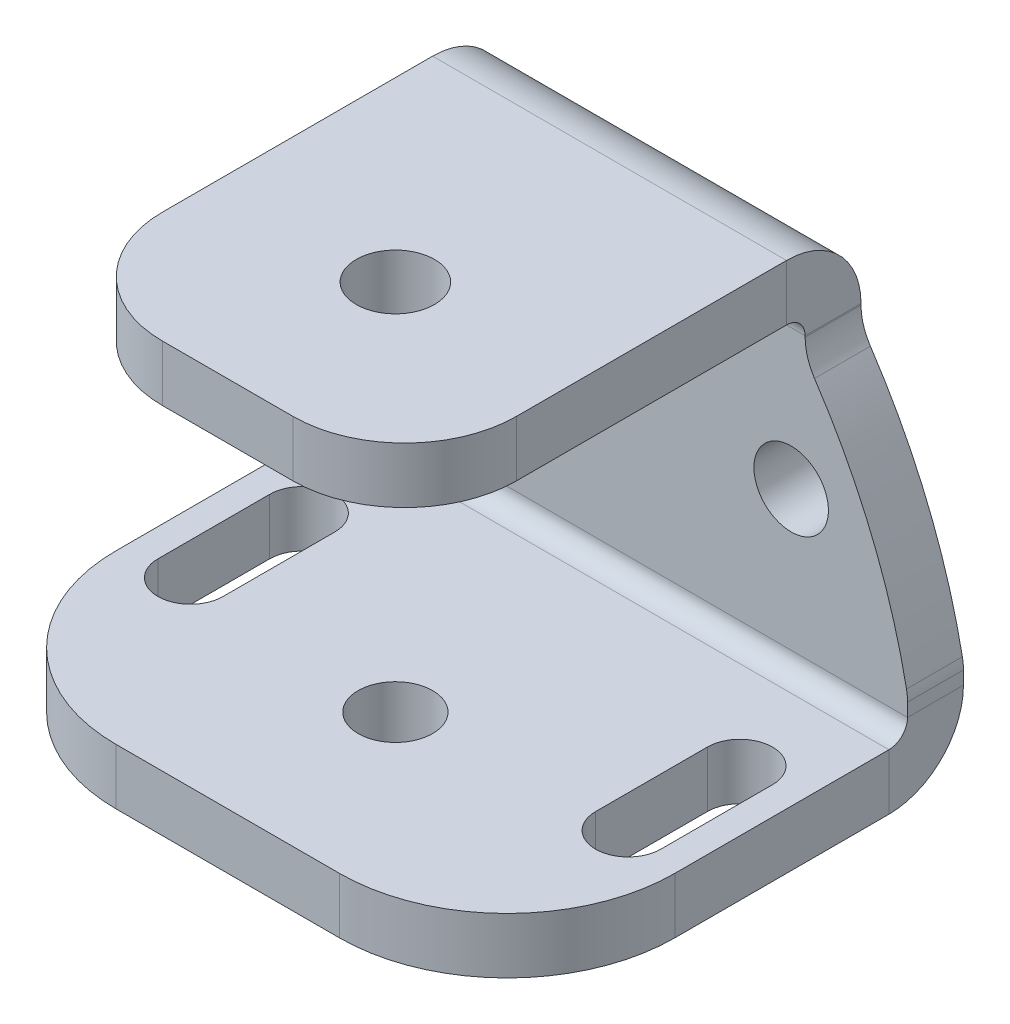
from build123d import *

# Parameters (mm, degrees)
BRIDA_BASE1_DEPTH                = 3
BRIDA_DE_ARISTA1_STRIP_W         = 14
BRIDA_DE_ARISTA1_STRIP_H         = 3
BRIDA_DE_ARISTA1_STRIP_CUT_DEPTH = 30
BRIDA_DE_ARISTA1_DEPTH           = 30
BRIDA_DE_ARISTA2_DEPTH           = 19
CORTAR_EXTRUIR1_REACH            = 45.489
CROQUIS12_R                      = 2
CORTAR_EXTRUIR2_REACH            = 43.979
CORTAR_EXTRUIR6_REACH            = 45.592
CROQUIS26_R                      = 2
TALADRO_ROSCADO_M51_D            = 4.2
TALADRO_ROSCADO_M51_DEPTH        = 3
REDONDEO2_R                      = 9
REDONDEO3_R                      = 6
REDONDEO4_R                      = 3


# Sheet-metal steps are written as plain solids
with BuildPart() as part:
    # Croquis1 → Brida base1 (new body)
    with BuildSketch(Plane.XY):
        with BuildLine():
            Line((0, 0), (30, 0))
            Line((30, 0), (30, 2))
            ThreePointArc((30, 2), (27.949996593, 8.796152405), (24.5, 15))
            Line((24.5, 15), (24.5, 16))
            Line((24.5, 16), (5.5, 16))
            Line((5.5, 16), (5.5, 15))
            ThreePointArc((5.5, 15), (2.050003407, 8.796152405), (0, 2))
            Line((0, 2), (0, 0))
        make_face()
    extrude(amount=-BRIDA_BASE1_DEPTH)

    # Brida de arista1 strip (across the edge) → Brida de arista1 strip cut (cut)
    with BuildSketch(Plane.YZ):
        with Locations((-6, -1.5)):
            Rectangle(BRIDA_DE_ARISTA1_STRIP_W, BRIDA_DE_ARISTA1_STRIP_H)
    extrude(amount=BRIDA_DE_ARISTA1_STRIP_CUT_DEPTH, mode=Mode.SUBTRACT)

    # Brida de arista1 section (across the edge) → Brida de arista1 (add)
    with BuildSketch(Plane.YZ):
        with BuildLine():
            Line((-3, 1), (-3, 21.5))
            Line((-3, 21.5), (0, 21.5))
            Line((0, 21.5), (0, 1))
            ThreePointArc((0, 1), (0.292893219, 0.292893219), (1, 0))
            Line((1, 0), (1, -3))
            ThreePointArc((1, -3), (-1.828427125, -1.828427125), (-3, 1))
        make_face()
    extrude(amount=BRIDA_DE_ARISTA1_DEPTH)

    # Brida de arista2 section (across the edge) → Brida de arista2 (add)
    with BuildSketch(Plane(origin=(24.5, 17, 0), x_dir=(0, -1, 0), z_dir=(-1, 0, 0))):
        with BuildLine():
            Line((-3, 1), (-3, 21.5))
            Line((-3, 21.5), (0, 21.5))
            Line((0, 21.5), (0, 1))
            ThreePointArc((0, 1), (0.292893219, 0.292893219), (1, 0))
            Line((1, 0), (1, -3))
            ThreePointArc((1, -3), (-1.828427125, -1.828427125), (-3, 1))
        make_face()
    extrude(amount=BRIDA_DE_ARISTA2_DEPTH)

    # Croquis12 → Cortar-Extruir1 (cut, up to next)
    with BuildSketch(Plane(origin=(0, -3, 0), x_dir=(1, 0, 0), z_dir=(0, 1, 0)), mode=Mode.PRIVATE) as cortar_extruir1_sk1:
        with Locations(Location((15, -12.5, 0), (0, 0, 270))):
            Circle(CROQUIS12_R)
    cortar_extruir1_tool1 = extrude(cortar_extruir1_sk1.sketch, amount=CORTAR_EXTRUIR1_REACH, mode=Mode.PRIVATE) & part.part
    add(cortar_extruir1_tool1.solids().sort_by_distance((15, -3, 12.5))[0], mode=Mode.SUBTRACT)

    # Croquis13 → Cortar-Extruir2 (cut, up to next)
    with BuildSketch(Plane(origin=(0, 0, 0), x_dir=(1, 0, 0), z_dir=(0, 1, 0)), mode=Mode.PRIVATE) as cortar_extruir2_sk1:
        with BuildLine():
            Line((5, -5.75), (5, -11.75))
            ThreePointArc((5, -11.75), (3.25, -13.5), (1.5, -11.75))
            Line((1.5, -11.75), (1.5, -5.75))
            ThreePointArc((1.5, -5.75), (3.25, -4), (5, -5.75))
        make_face()
    cortar_extruir2_tool1 = extrude(cortar_extruir2_sk1.sketch, amount=-CORTAR_EXTRUIR2_REACH, mode=Mode.PRIVATE) & part.part
    # Croquis13 → Cortar-Extruir2 (cut, up to next)
    with BuildSketch(Plane(origin=(0, 0, 0), x_dir=(1, 0, 0), z_dir=(0, 1, 0)), mode=Mode.PRIVATE) as cortar_extruir2_sk2:
        with BuildLine():
            Line((25, -5.75), (25, -11.75))
            ThreePointArc((25, -11.75), (26.75, -13.5), (28.5, -11.75))
            Line((28.5, -11.75), (28.5, -5.75))
            ThreePointArc((28.5, -5.75), (26.75, -4), (25, -5.75))
        make_face()
    cortar_extruir2_tool2 = extrude(cortar_extruir2_sk2.sketch, amount=-CORTAR_EXTRUIR2_REACH, mode=Mode.PRIVATE) & part.part
    add(cortar_extruir2_tool1.solids().sort_by_distance((3.25, 0, 8.75))[0], mode=Mode.SUBTRACT)
    add(cortar_extruir2_tool2.solids().sort_by_distance((26.75, 0, 8.75))[0], mode=Mode.SUBTRACT)

    # Croquis26 → Cortar-Extruir6 (cut, up to next)
    with BuildSketch(Plane(origin=(0, 0, -3), x_dir=(-1, 0, 0), z_dir=(0, 0, -1)), mode=Mode.PRIVATE) as cortar_extruir6_sk1:
        with Locations((-6.25, 8.5)):
            Circle(CROQUIS26_R)
    cortar_extruir6_tool1 = extrude(cortar_extruir6_sk1.sketch, amount=-CORTAR_EXTRUIR6_REACH, mode=Mode.PRIVATE) & part.part
    # Croquis26 → Cortar-Extruir6 (cut, up to next)
    with BuildSketch(Plane(origin=(0, 0, -3), x_dir=(-1, 0, 0), z_dir=(0, 0, -1)), mode=Mode.PRIVATE) as cortar_extruir6_sk2:
        with Locations((-23.75, 8.5)):
            Circle(CROQUIS26_R)
    cortar_extruir6_tool2 = extrude(cortar_extruir6_sk2.sketch, amount=-CORTAR_EXTRUIR6_REACH, mode=Mode.PRIVATE) & part.part
    add(cortar_extruir6_tool1.solids().sort_by_distance((6.25, 8.5, -3))[0], mode=Mode.SUBTRACT)
    add(cortar_extruir6_tool2.solids().sort_by_distance((23.75, 8.5, -3))[0], mode=Mode.SUBTRACT)

    # Taladro roscado M51
    with Locations(Plane(origin=(15, 20, 12.5), x_dir=(0, 0, 1), z_dir=(0, 1, 0))):
        with Locations((0, 0)):
            Hole(TALADRO_ROSCADO_M51_D / 2, depth=TALADRO_ROSCADO_M51_DEPTH)

    # Redondeo2
    redondeo2_edges = [part.edges().sort_by_distance(p)[0] for p in [
        (0, -1.5, 21.5),
        (30, -1.5, 21.5),
    ]]
    fillet(redondeo2_edges, radius=REDONDEO2_R)

    # Redondeo3
    redondeo3_edges = [part.edges().sort_by_distance(p)[0] for p in [
        (24.5, 18.5, 21.5),
        (5.5, 18.5, 21.5),
    ]]
    fillet(redondeo3_edges, radius=REDONDEO3_R)

    # Redondeo4
    redondeo4_edges = [part.edges().sort_by_distance(p)[0] for p in [
        (0, 2, -1.5),
        (5.5, 15, -1.5),
        (24.5, 15, -1.5),
        (30, 2, -1.5),
    ]]
    fillet(redondeo4_edges, radius=REDONDEO4_R)


solid = part.part
